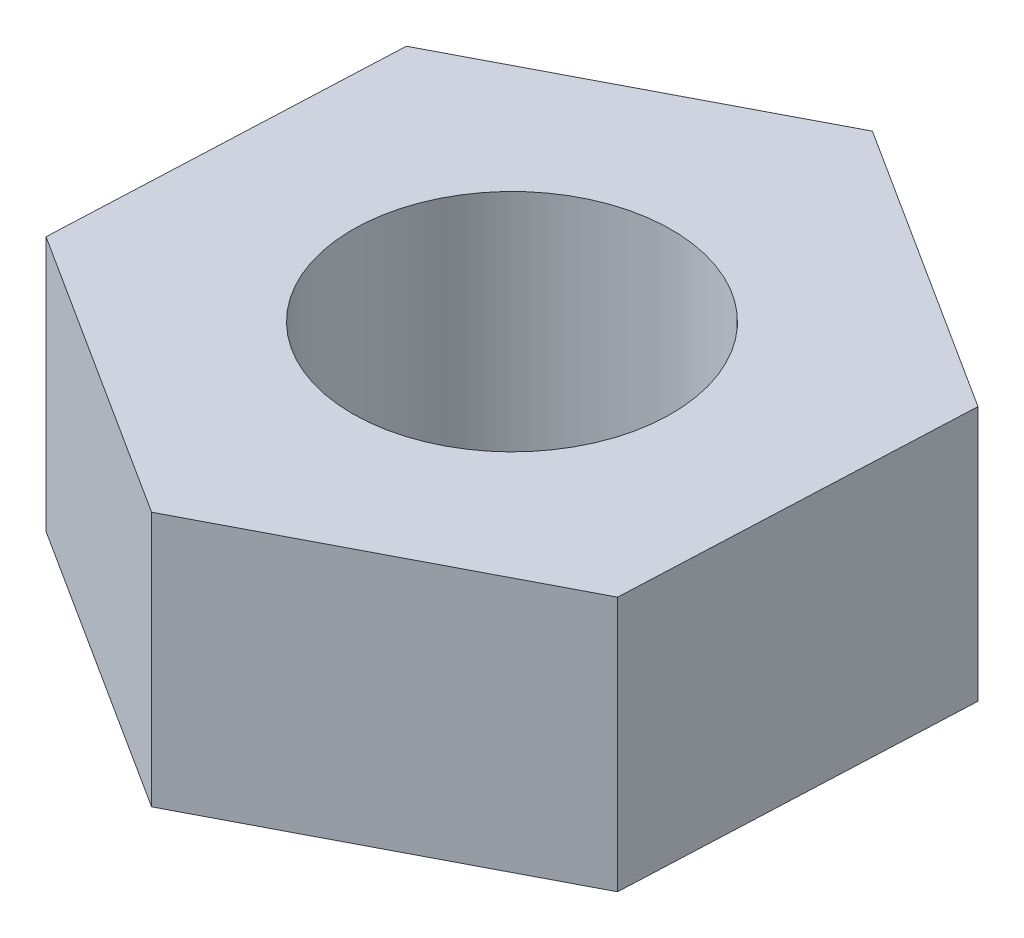
from build123d import *

# Parameters (mm, degrees)
BOSS_EXTRUDE1_DEPTH = 4.8
SKETCH2_R           = 3
CUT_EXTRUDE1_DEPTH  = 5.5


with BuildPart() as part:
    # Sketch1 → Boss-Extrude1 (new body)
    with BuildSketch(Plane(origin=(0, 0, 0), x_dir=(1, 0, 0), z_dir=(0, 1, 0))):
        Polygon((5.480812472, -3.494380438), (5.766628466, 2.999332615), (0.285815994, 6.493713053), (-5.480812472, 3.494380438), (-5.766628466, -2.999332615), (-0.285815994, -6.493713053), align=None)
    extrude(amount=BOSS_EXTRUDE1_DEPTH)

    # Sketch2 → Cut-Extrude1 (cut)
    with BuildSketch(Plane(origin=(0, 4.8, 0), x_dir=(1, 0, 0), z_dir=(0, 1, 0))):
        Circle(SKETCH2_R)
    extrude(amount=-CUT_EXTRUDE1_DEPTH, mode=Mode.SUBTRACT)


solid = part.part
